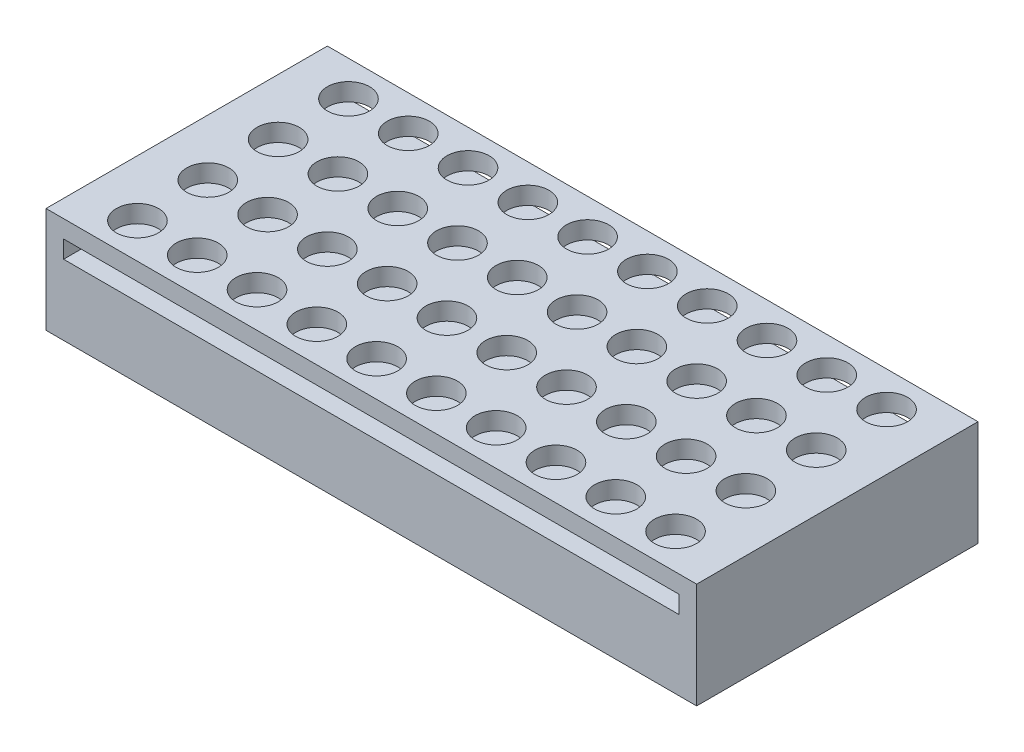
from build123d import *

# Parameters (mm, degrees)
SKETCH_1_W             = 355
SKETCH_1_H             = 80
EXTRUDE_3_DEPTH        = 30
SKETCH_2_W             = 345
SKETCH_2_H             = 5
CUT_EXTRUDE_1_DEPTH    = 366.136960605
SKETCH_3_R             = 6
CUT_EXTRUDE_2_DEPTH    = 5
PATTERN_LINEAR_1_COUNT = 20
PATTERN_LINEAR_1_PITCH = 17
PATTERN_LINEAR_2_COUNT = 2
PATTERN_LINEAR_2_PITCH = 20
SKETCH_8_R             = 8
SKETCH_7_R             = 6
PATTERN_LINEAR_4_COUNT = 20
PATTERN_LINEAR_4_PITCH = 17
PATTERN_LINEAR_5_COUNT = 2
PATTERN_LINEAR_5_PITCH = 20
SKETCH_10_W            = 177.5
SKETCH_10_H            = 30
CUT_EXTRUDE_3_DEPTH    = 188
SKETCH_11_W            = 7.5
SKETCH_11_H            = 80
EXTRUDE_4_DEPTH        = 30
SKETCH_12_W            = 2.5
SKETCH_12_H            = 5
CUT_EXTRUDE_4_DEPTH    = 98


with BuildPart() as part:
    # 草图1 → 凸台-拉伸3 (new body)
    with BuildSketch(Plane(origin=(0, 0, 0), x_dir=(1, 0, 0), z_dir=(0, 1, 0))):
        with Locations((177.5, 40)):
            Rectangle(SKETCH_1_W, SKETCH_1_H)
    extrude(amount=EXTRUDE_3_DEPTH)

    # 草图2 → 切除-拉伸1 (cut, through all)
    with BuildSketch(Plane.XY):
        with Locations((177.5, 22.5)):
            Rectangle(SKETCH_2_W, SKETCH_2_H)
    extrude(amount=-CUT_EXTRUDE_1_DEPTH, mode=Mode.SUBTRACT)

    # 草图3 → 切除-拉伸2 (cut)
    with BuildSketch(Plane(origin=(0, 30, 0), x_dir=(1, 0, 0), z_dir=(0, 1, 0))):
        with Locations(Location((16, 70, 0), (0, 0, 270))):
            Circle(SKETCH_3_R)
        with Locations(Location((33, 70, 0), (0, 0, 270))):
            Circle(SKETCH_3_R)
        with Locations(Location((50, 70, 0), (0, 0, 270))):
            Circle(SKETCH_3_R)
        with Locations(Location((67, 70, 0), (0, 0, 270))):
            Circle(SKETCH_3_R)
        with Locations(Location((84, 70, 0), (0, 0, 270))):
            Circle(SKETCH_3_R)
        with Locations(Location((101, 70, 0), (0, 0, 270))):
            Circle(SKETCH_3_R)
        with Locations(Location((118, 70, 0), (0, 0, 270))):
            Circle(SKETCH_3_R)
        with Locations(Location((135, 70, 0), (0, 0, 270))):
            Circle(SKETCH_3_R)
        with Locations(Location((152, 70, 0), (0, 0, 270))):
            Circle(SKETCH_3_R)
        with Locations(Location((169, 70, 0), (0, 0, 270))):
            Circle(SKETCH_3_R)
        with Locations(Location((186, 70, 0), (0, 0, 270))):
            Circle(SKETCH_3_R)
        with Locations(Location((203, 70, 0), (0, 0, 270))):
            Circle(SKETCH_3_R)
        with Locations(Location((220, 70, 0), (0, 0, 270))):
            Circle(SKETCH_3_R)
        with Locations(Location((237, 70, 0), (0, 0, 270))):
            Circle(SKETCH_3_R)
        with Locations(Location((254, 70, 0), (0, 0, 270))):
            Circle(SKETCH_3_R)
        with Locations(Location((271, 70, 0), (0, 0, 270))):
            Circle(SKETCH_3_R)
        with Locations(Location((288, 70, 0), (0, 0, 270))):
            Circle(SKETCH_3_R)
        with Locations(Location((305, 70, 0), (0, 0, 270))):
            Circle(SKETCH_3_R)
        with Locations(Location((322, 70, 0), (0, 0, 270))):
            Circle(SKETCH_3_R)
        with Locations(Location((339, 70, 0), (0, 0, 270))):
            Circle(SKETCH_3_R)
        with Locations(Location((16, 50, 0), (0, 0, 270))):
            Circle(SKETCH_3_R)
        with Locations(Location((16, 30, 0), (0, 0, 270))):
            Circle(SKETCH_3_R)
        with Locations(Location((16, 10, 0), (0, 0, 270))):
            Circle(SKETCH_3_R)
        with Locations(Location((33, 50, 0), (0, 0, 270))):
            Circle(SKETCH_3_R)
        with Locations(Location((50, 50, 0), (0, 0, 270))):
            Circle(SKETCH_3_R)
        with Locations(Location((67, 50, 0), (0, 0, 270))):
            Circle(SKETCH_3_R)
        with Locations(Location((84, 50, 0), (0, 0, 270))):
            Circle(SKETCH_3_R)
        with Locations(Location((101, 50, 0), (0, 0, 270))):
            Circle(SKETCH_3_R)
        with Locations(Location((118, 50, 0), (0, 0, 270))):
            Circle(SKETCH_3_R)
        with Locations(Location((135, 50, 0), (0, 0, 270))):
            Circle(SKETCH_3_R)
        with Locations(Location((152, 50, 0), (0, 0, 270))):
            Circle(SKETCH_3_R)
        with Locations(Location((169, 50, 0), (0, 0, 270))):
            Circle(SKETCH_3_R)
        with Locations(Location((186, 50, 0), (0, 0, 270))):
            Circle(SKETCH_3_R)
        with Locations(Location((203, 50, 0), (0, 0, 270))):
            Circle(SKETCH_3_R)
        with Locations(Location((220, 50, 0), (0, 0, 270))):
            Circle(SKETCH_3_R)
        with Locations(Location((237, 50, 0), (0, 0, 270))):
            Circle(SKETCH_3_R)
        with Locations(Location((254, 50, 0), (0, 0, 270))):
            Circle(SKETCH_3_R)
        with Locations(Location((271, 50, 0), (0, 0, 270))):
            Circle(SKETCH_3_R)
        with Locations(Location((288, 50, 0), (0, 0, 270))):
            Circle(SKETCH_3_R)
        with Locations(Location((305, 50, 0), (0, 0, 270))):
            Circle(SKETCH_3_R)
        with Locations(Location((322, 50, 0), (0, 0, 270))):
            Circle(SKETCH_3_R)
        with Locations(Location((339, 50, 0), (0, 0, 270))):
            Circle(SKETCH_3_R)
        with Locations(Location((33, 30, 0), (0, 0, 270))):
            Circle(SKETCH_3_R)
        with Locations(Location((50, 30, 0), (0, 0, 270))):
            Circle(SKETCH_3_R)
        with Locations(Location((67, 30, 0), (0, 0, 270))):
            Circle(SKETCH_3_R)
        with Locations(Location((84, 30, 0), (0, 0, 270))):
            Circle(SKETCH_3_R)
        with Locations(Location((101, 30, 0), (0, 0, 270))):
            Circle(SKETCH_3_R)
        with Locations(Location((118, 30, 0), (0, 0, 270))):
            Circle(SKETCH_3_R)
        with Locations(Location((135, 30, 0), (0, 0, 270))):
            Circle(SKETCH_3_R)
        with Locations(Location((152, 30, 0), (0, 0, 270))):
            Circle(SKETCH_3_R)
        with Locations(Location((169, 30, 0), (0, 0, 270))):
            Circle(SKETCH_3_R)
        with Locations(Location((186, 30, 0), (0, 0, 270))):
            Circle(SKETCH_3_R)
        with Locations(Location((203, 30, 0), (0, 0, 270))):
            Circle(SKETCH_3_R)
        with Locations(Location((220, 30, 0), (0, 0, 270))):
            Circle(SKETCH_3_R)
        with Locations(Location((237, 30, 0), (0, 0, 270))):
            Circle(SKETCH_3_R)
        with Locations(Location((254, 30, 0), (0, 0, 270))):
            Circle(SKETCH_3_R)
        with Locations(Location((271, 30, 0), (0, 0, 270))):
            Circle(SKETCH_3_R)
        with Locations(Location((288, 30, 0), (0, 0, 270))):
            Circle(SKETCH_3_R)
        with Locations(Location((305, 30, 0), (0, 0, 270))):
            Circle(SKETCH_3_R)
        with Locations(Location((322, 30, 0), (0, 0, 270))):
            Circle(SKETCH_3_R)
        with Locations(Location((339, 30, 0), (0, 0, 270))):
            Circle(SKETCH_3_R)
        with Locations(Location((33, 10, 0), (0, 0, 270))):
            Circle(SKETCH_3_R)
        with Locations(Location((50, 10, 0), (0, 0, 270))):
            Circle(SKETCH_3_R)
        with Locations(Location((67, 10, 0), (0, 0, 270))):
            Circle(SKETCH_3_R)
        with Locations(Location((84, 10, 0), (0, 0, 270))):
            Circle(SKETCH_3_R)
        with Locations(Location((101, 10, 0), (0, 0, 270))):
            Circle(SKETCH_3_R)
        with Locations(Location((118, 10, 0), (0, 0, 270))):
            Circle(SKETCH_3_R)
        with Locations(Location((135, 10, 0), (0, 0, 270))):
            Circle(SKETCH_3_R)
        with Locations(Location((152, 10, 0), (0, 0, 270))):
            Circle(SKETCH_3_R)
        with Locations(Location((169, 10, 0), (0, 0, 270))):
            Circle(SKETCH_3_R)
        with Locations(Location((186, 10, 0), (0, 0, 270))):
            Circle(SKETCH_3_R)
        with Locations(Location((203, 10, 0), (0, 0, 270))):
            Circle(SKETCH_3_R)
        with Locations(Location((220, 10, 0), (0, 0, 270))):
            Circle(SKETCH_3_R)
        with Locations(Location((237, 10, 0), (0, 0, 270))):
            Circle(SKETCH_3_R)
        with Locations(Location((254, 10, 0), (0, 0, 270))):
            Circle(SKETCH_3_R)
        with Locations(Location((271, 10, 0), (0, 0, 270))):
            Circle(SKETCH_3_R)
        with Locations(Location((288, 10, 0), (0, 0, 270))):
            Circle(SKETCH_3_R)
        with Locations(Location((305, 10, 0), (0, 0, 270))):
            Circle(SKETCH_3_R)
        with Locations(Location((322, 10, 0), (0, 0, 270))):
            Circle(SKETCH_3_R)
        with Locations(Location((339, 10, 0), (0, 0, 270))):
            Circle(SKETCH_3_R)
    extrude(amount=-CUT_EXTRUDE_2_DEPTH, mode=Mode.SUBTRACT)

    # 切除-放样1: read off the stored shape, not the designer's step
    # 切除-放样1: loft between two sections, ruled curve by curve
    loft_1_from = [
        Edge.make_bspline([(16.29384385, 0, -14.49039595), (7.313051949, 0, -15.07808365), (6.725364249, 0, -6.09729175), (15.70615615, 0, -5.50960405), (24.686948051, 0, -4.92191635), (25.274635751, 0, -13.90270825), (16.29384385, 0, -14.49039595)], [0, 0, 0, 0, 0.5, 0.5, 0.5, 1, 1, 1, 1], 3, [1, 0.333333333, 0.333333333, 1, 0.333333333, 0.333333333, 1]),
    ]
    loft_1_to = [
        Edge.make_bspline([(15.369563504, 20, -12.419204378), (10.531154747, 20, -11.158331387), (11.792027739, 20, -6.31992263), (16.630436496, 20, -7.580795622), (21.468845253, 20, -8.841668613), (20.207972261, 20, -13.68007737), (15.369563504, 20, -12.419204378)], [0, 0, 0, 0, 0.5, 0.5, 0.5, 1, 1, 1, 1], 3, [1, 0.333333333, 0.333333333, 1, 0.333333333, 0.333333333, 1]),
    ]
    loft_1 = Solid(Shell([*[Face.make_surface_from_curves(loft_1_from[k], loft_1_to[k]) for k in range(1)], Face(Wire(loft_1_from)), Face(Wire(loft_1_to))]))
    add(loft_1, mode=Mode.SUBTRACT)

    # 阵列(线性)1: 切除-放样1 ×20
    with Locations(*[(i * PATTERN_LINEAR_1_PITCH, 0, 0) for i in range(1, PATTERN_LINEAR_1_COUNT)]):
        add(loft_1, mode=Mode.SUBTRACT)

    # 阵列(线性)2: 切除-放样1 ×2
    with Locations(*[(0, 0, -i * PATTERN_LINEAR_2_PITCH) for i in range(1, PATTERN_LINEAR_2_COUNT)]):
        add(loft_1, mode=Mode.SUBTRACT)

    # 阵列(线性)3: read off the stored shape, not the designer's step
    # 阵列(线性)3: loft between two sections, ruled curve by curve
    pattern_linear_3_from = [
        Edge.make_bspline([(339.29384385, 0, -34.49039595), (330.313051949, 0, -35.07808365), (329.725364249, 0, -26.09729175), (338.70615615, 0, -25.50960405), (347.686948051, 0, -24.92191635), (348.274635751, 0, -33.90270825), (339.29384385, 0, -34.49039595)], [0, 0, 0, 0, 0.5, 0.5, 0.5, 1, 1, 1, 1], 3, [1, 0.333333333, 0.333333333, 1, 0.333333333, 0.333333333, 1]),
    ]
    pattern_linear_3_to = [
        Edge.make_bspline([(338.369563504, 20, -32.419204378), (333.531154747, 20, -31.158331387), (334.792027739, 20, -26.31992263), (339.630436496, 20, -27.580795622), (344.468845253, 20, -28.841668613), (343.207972261, 20, -33.68007737), (338.369563504, 20, -32.419204378)], [0, 0, 0, 0, 0.5, 0.5, 0.5, 1, 1, 1, 1], 3, [1, 0.333333333, 0.333333333, 1, 0.333333333, 0.333333333, 1]),
    ]
    pattern_linear_3 = Solid(Shell([*[Face.make_surface_from_curves(pattern_linear_3_from[k], pattern_linear_3_to[k]) for k in range(1)], Face(Wire(pattern_linear_3_from)), Face(Wire(pattern_linear_3_to))]))
    add(pattern_linear_3, mode=Mode.SUBTRACT)

    # Pattern Linear 3 2: loft between two sections, ruled curve by curve
    pattern_linear_3_2_from = [
        Edge.make_bspline([(322.29384385, 0, -34.49039595), (313.313051949, 0, -35.07808365), (312.725364249, 0, -26.09729175), (321.70615615, 0, -25.50960405), (330.686948051, 0, -24.92191635), (331.274635751, 0, -33.90270825), (322.29384385, 0, -34.49039595)], [0, 0, 0, 0, 0.5, 0.5, 0.5, 1, 1, 1, 1], 3, [1, 0.333333333, 0.333333333, 1, 0.333333333, 0.333333333, 1]),
    ]
    pattern_linear_3_2_to = [
        Edge.make_bspline([(321.369563504, 20, -32.419204378), (316.531154747, 20, -31.158331387), (317.792027739, 20, -26.31992263), (322.630436496, 20, -27.580795622), (327.468845253, 20, -28.841668613), (326.207972261, 20, -33.68007737), (321.369563504, 20, -32.419204378)], [0, 0, 0, 0, 0.5, 0.5, 0.5, 1, 1, 1, 1], 3, [1, 0.333333333, 0.333333333, 1, 0.333333333, 0.333333333, 1]),
    ]
    pattern_linear_3_2 = Solid(Shell([*[Face.make_surface_from_curves(pattern_linear_3_2_from[k], pattern_linear_3_2_to[k]) for k in range(1)], Face(Wire(pattern_linear_3_2_from)), Face(Wire(pattern_linear_3_2_to))]))
    add(pattern_linear_3_2, mode=Mode.SUBTRACT)

    # Pattern Linear 3 3: loft between two sections, ruled curve by curve
    pattern_linear_3_3_from = [
        Edge.make_bspline([(305.29384385, 0, -34.49039595), (296.313051949, 0, -35.07808365), (295.725364249, 0, -26.09729175), (304.70615615, 0, -25.50960405), (313.686948051, 0, -24.92191635), (314.274635751, 0, -33.90270825), (305.29384385, 0, -34.49039595)], [0, 0, 0, 0, 0.5, 0.5, 0.5, 1, 1, 1, 1], 3, [1, 0.333333333, 0.333333333, 1, 0.333333333, 0.333333333, 1]),
    ]
    pattern_linear_3_3_to = [
        Edge.make_bspline([(304.369563504, 20, -32.419204378), (299.531154747, 20, -31.158331387), (300.792027739, 20, -26.31992263), (305.630436496, 20, -27.580795622), (310.468845253, 20, -28.841668613), (309.207972261, 20, -33.68007737), (304.369563504, 20, -32.419204378)], [0, 0, 0, 0, 0.5, 0.5, 0.5, 1, 1, 1, 1], 3, [1, 0.333333333, 0.333333333, 1, 0.333333333, 0.333333333, 1]),
    ]
    pattern_linear_3_3 = Solid(Shell([*[Face.make_surface_from_curves(pattern_linear_3_3_from[k], pattern_linear_3_3_to[k]) for k in range(1)], Face(Wire(pattern_linear_3_3_from)), Face(Wire(pattern_linear_3_3_to))]))
    add(pattern_linear_3_3, mode=Mode.SUBTRACT)

    # Pattern Linear 3 4: loft between two sections, ruled curve by curve
    pattern_linear_3_4_from = [
        Edge.make_bspline([(288.29384385, 0, -34.49039595), (279.313051949, 0, -35.07808365), (278.725364249, 0, -26.09729175), (287.70615615, 0, -25.50960405), (296.686948051, 0, -24.92191635), (297.274635751, 0, -33.90270825), (288.29384385, 0, -34.49039595)], [0, 0, 0, 0, 0.5, 0.5, 0.5, 1, 1, 1, 1], 3, [1, 0.333333333, 0.333333333, 1, 0.333333333, 0.333333333, 1]),
    ]
    pattern_linear_3_4_to = [
        Edge.make_bspline([(287.369563504, 20, -32.419204378), (282.531154747, 20, -31.158331387), (283.792027739, 20, -26.31992263), (288.630436496, 20, -27.580795622), (293.468845253, 20, -28.841668613), (292.207972261, 20, -33.68007737), (287.369563504, 20, -32.419204378)], [0, 0, 0, 0, 0.5, 0.5, 0.5, 1, 1, 1, 1], 3, [1, 0.333333333, 0.333333333, 1, 0.333333333, 0.333333333, 1]),
    ]
    pattern_linear_3_4 = Solid(Shell([*[Face.make_surface_from_curves(pattern_linear_3_4_from[k], pattern_linear_3_4_to[k]) for k in range(1)], Face(Wire(pattern_linear_3_4_from)), Face(Wire(pattern_linear_3_4_to))]))
    add(pattern_linear_3_4, mode=Mode.SUBTRACT)

    # Pattern Linear 3 5: loft between two sections, ruled curve by curve
    pattern_linear_3_5_from = [
        Edge.make_bspline([(271.29384385, 0, -34.49039595), (262.313051949, 0, -35.07808365), (261.725364249, 0, -26.09729175), (270.70615615, 0, -25.50960405), (279.686948051, 0, -24.92191635), (280.274635751, 0, -33.90270825), (271.29384385, 0, -34.49039595)], [0, 0, 0, 0, 0.5, 0.5, 0.5, 1, 1, 1, 1], 3, [1, 0.333333333, 0.333333333, 1, 0.333333333, 0.333333333, 1]),
    ]
    pattern_linear_3_5_to = [
        Edge.make_bspline([(270.369563504, 20, -32.419204378), (265.531154747, 20, -31.158331387), (266.792027739, 20, -26.31992263), (271.630436496, 20, -27.580795622), (276.468845253, 20, -28.841668613), (275.207972261, 20, -33.68007737), (270.369563504, 20, -32.419204378)], [0, 0, 0, 0, 0.5, 0.5, 0.5, 1, 1, 1, 1], 3, [1, 0.333333333, 0.333333333, 1, 0.333333333, 0.333333333, 1]),
    ]
    pattern_linear_3_5 = Solid(Shell([*[Face.make_surface_from_curves(pattern_linear_3_5_from[k], pattern_linear_3_5_to[k]) for k in range(1)], Face(Wire(pattern_linear_3_5_from)), Face(Wire(pattern_linear_3_5_to))]))
    add(pattern_linear_3_5, mode=Mode.SUBTRACT)

    # Pattern Linear 3 6: loft between two sections, ruled curve by curve
    pattern_linear_3_6_from = [
        Edge.make_bspline([(254.29384385, 0, -34.49039595), (245.313051949, 0, -35.07808365), (244.725364249, 0, -26.09729175), (253.70615615, 0, -25.50960405), (262.686948051, 0, -24.92191635), (263.274635751, 0, -33.90270825), (254.29384385, 0, -34.49039595)], [0, 0, 0, 0, 0.5, 0.5, 0.5, 1, 1, 1, 1], 3, [1, 0.333333333, 0.333333333, 1, 0.333333333, 0.333333333, 1]),
    ]
    pattern_linear_3_6_to = [
        Edge.make_bspline([(253.369563504, 20, -32.419204378), (248.531154747, 20, -31.158331387), (249.792027739, 20, -26.31992263), (254.630436496, 20, -27.580795622), (259.468845253, 20, -28.841668613), (258.207972261, 20, -33.68007737), (253.369563504, 20, -32.419204378)], [0, 0, 0, 0, 0.5, 0.5, 0.5, 1, 1, 1, 1], 3, [1, 0.333333333, 0.333333333, 1, 0.333333333, 0.333333333, 1]),
    ]
    pattern_linear_3_6 = Solid(Shell([*[Face.make_surface_from_curves(pattern_linear_3_6_from[k], pattern_linear_3_6_to[k]) for k in range(1)], Face(Wire(pattern_linear_3_6_from)), Face(Wire(pattern_linear_3_6_to))]))
    add(pattern_linear_3_6, mode=Mode.SUBTRACT)

    # Pattern Linear 3 7: loft between two sections, ruled curve by curve
    pattern_linear_3_7_from = [
        Edge.make_bspline([(237.29384385, 0, -34.49039595), (228.313051949, 0, -35.07808365), (227.725364249, 0, -26.09729175), (236.70615615, 0, -25.50960405), (245.686948051, 0, -24.92191635), (246.274635751, 0, -33.90270825), (237.29384385, 0, -34.49039595)], [0, 0, 0, 0, 0.5, 0.5, 0.5, 1, 1, 1, 1], 3, [1, 0.333333333, 0.333333333, 1, 0.333333333, 0.333333333, 1]),
    ]
    pattern_linear_3_7_to = [
        Edge.make_bspline([(236.369563504, 20, -32.419204378), (231.531154747, 20, -31.158331387), (232.792027739, 20, -26.31992263), (237.630436496, 20, -27.580795622), (242.468845253, 20, -28.841668613), (241.207972261, 20, -33.68007737), (236.369563504, 20, -32.419204378)], [0, 0, 0, 0, 0.5, 0.5, 0.5, 1, 1, 1, 1], 3, [1, 0.333333333, 0.333333333, 1, 0.333333333, 0.333333333, 1]),
    ]
    pattern_linear_3_7 = Solid(Shell([*[Face.make_surface_from_curves(pattern_linear_3_7_from[k], pattern_linear_3_7_to[k]) for k in range(1)], Face(Wire(pattern_linear_3_7_from)), Face(Wire(pattern_linear_3_7_to))]))
    add(pattern_linear_3_7, mode=Mode.SUBTRACT)

    # Pattern Linear 3 8: loft between two sections, ruled curve by curve
    pattern_linear_3_8_from = [
        Edge.make_bspline([(220.29384385, 0, -34.49039595), (211.313051949, 0, -35.07808365), (210.725364249, 0, -26.09729175), (219.70615615, 0, -25.50960405), (228.686948051, 0, -24.92191635), (229.274635751, 0, -33.90270825), (220.29384385, 0, -34.49039595)], [0, 0, 0, 0, 0.5, 0.5, 0.5, 1, 1, 1, 1], 3, [1, 0.333333333, 0.333333333, 1, 0.333333333, 0.333333333, 1]),
    ]
    pattern_linear_3_8_to = [
        Edge.make_bspline([(219.369563504, 20, -32.419204378), (214.531154747, 20, -31.158331387), (215.792027739, 20, -26.31992263), (220.630436496, 20, -27.580795622), (225.468845253, 20, -28.841668613), (224.207972261, 20, -33.68007737), (219.369563504, 20, -32.419204378)], [0, 0, 0, 0, 0.5, 0.5, 0.5, 1, 1, 1, 1], 3, [1, 0.333333333, 0.333333333, 1, 0.333333333, 0.333333333, 1]),
    ]
    pattern_linear_3_8 = Solid(Shell([*[Face.make_surface_from_curves(pattern_linear_3_8_from[k], pattern_linear_3_8_to[k]) for k in range(1)], Face(Wire(pattern_linear_3_8_from)), Face(Wire(pattern_linear_3_8_to))]))
    add(pattern_linear_3_8, mode=Mode.SUBTRACT)

    # Pattern Linear 3 9: loft between two sections, ruled curve by curve
    pattern_linear_3_9_from = [
        Edge.make_bspline([(203.29384385, 0, -34.49039595), (194.313051949, 0, -35.07808365), (193.725364249, 0, -26.09729175), (202.70615615, 0, -25.50960405), (211.686948051, 0, -24.92191635), (212.274635751, 0, -33.90270825), (203.29384385, 0, -34.49039595)], [0, 0, 0, 0, 0.5, 0.5, 0.5, 1, 1, 1, 1], 3, [1, 0.333333333, 0.333333333, 1, 0.333333333, 0.333333333, 1]),
    ]
    pattern_linear_3_9_to = [
        Edge.make_bspline([(202.369563504, 20, -32.419204378), (197.531154747, 20, -31.158331387), (198.792027739, 20, -26.31992263), (203.630436496, 20, -27.580795622), (208.468845253, 20, -28.841668613), (207.207972261, 20, -33.68007737), (202.369563504, 20, -32.419204378)], [0, 0, 0, 0, 0.5, 0.5, 0.5, 1, 1, 1, 1], 3, [1, 0.333333333, 0.333333333, 1, 0.333333333, 0.333333333, 1]),
    ]
    pattern_linear_3_9 = Solid(Shell([*[Face.make_surface_from_curves(pattern_linear_3_9_from[k], pattern_linear_3_9_to[k]) for k in range(1)], Face(Wire(pattern_linear_3_9_from)), Face(Wire(pattern_linear_3_9_to))]))
    add(pattern_linear_3_9, mode=Mode.SUBTRACT)

    # Pattern Linear 3 10: loft between two sections, ruled curve by curve
    pattern_linear_3_10_from = [
        Edge.make_bspline([(186.29384385, 0, -34.49039595), (177.313051949, 0, -35.07808365), (176.725364249, 0, -26.09729175), (185.70615615, 0, -25.50960405), (194.686948051, 0, -24.92191635), (195.274635751, 0, -33.90270825), (186.29384385, 0, -34.49039595)], [0, 0, 0, 0, 0.5, 0.5, 0.5, 1, 1, 1, 1], 3, [1, 0.333333333, 0.333333333, 1, 0.333333333, 0.333333333, 1]),
    ]
    pattern_linear_3_10_to = [
        Edge.make_bspline([(185.369563504, 20, -32.419204378), (180.531154747, 20, -31.158331387), (181.792027739, 20, -26.31992263), (186.630436496, 20, -27.580795622), (191.468845253, 20, -28.841668613), (190.207972261, 20, -33.68007737), (185.369563504, 20, -32.419204378)], [0, 0, 0, 0, 0.5, 0.5, 0.5, 1, 1, 1, 1], 3, [1, 0.333333333, 0.333333333, 1, 0.333333333, 0.333333333, 1]),
    ]
    pattern_linear_3_10 = Solid(Shell([*[Face.make_surface_from_curves(pattern_linear_3_10_from[k], pattern_linear_3_10_to[k]) for k in range(1)], Face(Wire(pattern_linear_3_10_from)), Face(Wire(pattern_linear_3_10_to))]))
    add(pattern_linear_3_10, mode=Mode.SUBTRACT)

    # Pattern Linear 3 11: loft between two sections, ruled curve by curve
    pattern_linear_3_11_from = [
        Edge.make_bspline([(169.29384385, 0, -34.49039595), (160.313051949, 0, -35.07808365), (159.725364249, 0, -26.09729175), (168.70615615, 0, -25.50960405), (177.686948051, 0, -24.92191635), (178.274635751, 0, -33.90270825), (169.29384385, 0, -34.49039595)], [0, 0, 0, 0, 0.5, 0.5, 0.5, 1, 1, 1, 1], 3, [1, 0.333333333, 0.333333333, 1, 0.333333333, 0.333333333, 1]),
    ]
    pattern_linear_3_11_to = [
        Edge.make_bspline([(168.369563504, 20, -32.419204378), (163.531154747, 20, -31.158331387), (164.792027739, 20, -26.31992263), (169.630436496, 20, -27.580795622), (174.468845253, 20, -28.841668613), (173.207972261, 20, -33.68007737), (168.369563504, 20, -32.419204378)], [0, 0, 0, 0, 0.5, 0.5, 0.5, 1, 1, 1, 1], 3, [1, 0.333333333, 0.333333333, 1, 0.333333333, 0.333333333, 1]),
    ]
    pattern_linear_3_11 = Solid(Shell([*[Face.make_surface_from_curves(pattern_linear_3_11_from[k], pattern_linear_3_11_to[k]) for k in range(1)], Face(Wire(pattern_linear_3_11_from)), Face(Wire(pattern_linear_3_11_to))]))
    add(pattern_linear_3_11, mode=Mode.SUBTRACT)

    # Pattern Linear 3 12: loft between two sections, ruled curve by curve
    pattern_linear_3_12_from = [
        Edge.make_bspline([(152.29384385, 0, -34.49039595), (143.313051949, 0, -35.07808365), (142.725364249, 0, -26.09729175), (151.70615615, 0, -25.50960405), (160.686948051, 0, -24.92191635), (161.274635751, 0, -33.90270825), (152.29384385, 0, -34.49039595)], [0, 0, 0, 0, 0.5, 0.5, 0.5, 1, 1, 1, 1], 3, [1, 0.333333333, 0.333333333, 1, 0.333333333, 0.333333333, 1]),
    ]
    pattern_linear_3_12_to = [
        Edge.make_bspline([(151.369563504, 20, -32.419204378), (146.531154747, 20, -31.158331387), (147.792027739, 20, -26.31992263), (152.630436496, 20, -27.580795622), (157.468845253, 20, -28.841668613), (156.207972261, 20, -33.68007737), (151.369563504, 20, -32.419204378)], [0, 0, 0, 0, 0.5, 0.5, 0.5, 1, 1, 1, 1], 3, [1, 0.333333333, 0.333333333, 1, 0.333333333, 0.333333333, 1]),
    ]
    pattern_linear_3_12 = Solid(Shell([*[Face.make_surface_from_curves(pattern_linear_3_12_from[k], pattern_linear_3_12_to[k]) for k in range(1)], Face(Wire(pattern_linear_3_12_from)), Face(Wire(pattern_linear_3_12_to))]))
    add(pattern_linear_3_12, mode=Mode.SUBTRACT)

    # Pattern Linear 3 13: loft between two sections, ruled curve by curve
    pattern_linear_3_13_from = [
        Edge.make_bspline([(135.29384385, 0, -34.49039595), (126.313051949, 0, -35.07808365), (125.725364249, 0, -26.09729175), (134.70615615, 0, -25.50960405), (143.686948051, 0, -24.92191635), (144.274635751, 0, -33.90270825), (135.29384385, 0, -34.49039595)], [0, 0, 0, 0, 0.5, 0.5, 0.5, 1, 1, 1, 1], 3, [1, 0.333333333, 0.333333333, 1, 0.333333333, 0.333333333, 1]),
    ]
    pattern_linear_3_13_to = [
        Edge.make_bspline([(134.369563504, 20, -32.419204378), (129.531154747, 20, -31.158331387), (130.792027739, 20, -26.31992263), (135.630436496, 20, -27.580795622), (140.468845253, 20, -28.841668613), (139.207972261, 20, -33.68007737), (134.369563504, 20, -32.419204378)], [0, 0, 0, 0, 0.5, 0.5, 0.5, 1, 1, 1, 1], 3, [1, 0.333333333, 0.333333333, 1, 0.333333333, 0.333333333, 1]),
    ]
    pattern_linear_3_13 = Solid(Shell([*[Face.make_surface_from_curves(pattern_linear_3_13_from[k], pattern_linear_3_13_to[k]) for k in range(1)], Face(Wire(pattern_linear_3_13_from)), Face(Wire(pattern_linear_3_13_to))]))
    add(pattern_linear_3_13, mode=Mode.SUBTRACT)

    # Pattern Linear 3 14: loft between two sections, ruled curve by curve
    pattern_linear_3_14_from = [
        Edge.make_bspline([(118.29384385, 0, -34.49039595), (109.313051949, 0, -35.07808365), (108.725364249, 0, -26.09729175), (117.70615615, 0, -25.50960405), (126.686948051, 0, -24.92191635), (127.274635751, 0, -33.90270825), (118.29384385, 0, -34.49039595)], [0, 0, 0, 0, 0.5, 0.5, 0.5, 1, 1, 1, 1], 3, [1, 0.333333333, 0.333333333, 1, 0.333333333, 0.333333333, 1]),
    ]
    pattern_linear_3_14_to = [
        Edge.make_bspline([(117.369563504, 20, -32.419204378), (112.531154747, 20, -31.158331387), (113.792027739, 20, -26.31992263), (118.630436496, 20, -27.580795622), (123.468845253, 20, -28.841668613), (122.207972261, 20, -33.68007737), (117.369563504, 20, -32.419204378)], [0, 0, 0, 0, 0.5, 0.5, 0.5, 1, 1, 1, 1], 3, [1, 0.333333333, 0.333333333, 1, 0.333333333, 0.333333333, 1]),
    ]
    pattern_linear_3_14 = Solid(Shell([*[Face.make_surface_from_curves(pattern_linear_3_14_from[k], pattern_linear_3_14_to[k]) for k in range(1)], Face(Wire(pattern_linear_3_14_from)), Face(Wire(pattern_linear_3_14_to))]))
    add(pattern_linear_3_14, mode=Mode.SUBTRACT)

    # Pattern Linear 3 15: loft between two sections, ruled curve by curve
    pattern_linear_3_15_from = [
        Edge.make_bspline([(101.29384385, 0, -34.49039595), (92.313051949, 0, -35.07808365), (91.725364249, 0, -26.09729175), (100.70615615, 0, -25.50960405), (109.686948051, 0, -24.92191635), (110.274635751, 0, -33.90270825), (101.29384385, 0, -34.49039595)], [0, 0, 0, 0, 0.5, 0.5, 0.5, 1, 1, 1, 1], 3, [1, 0.333333333, 0.333333333, 1, 0.333333333, 0.333333333, 1]),
    ]
    pattern_linear_3_15_to = [
        Edge.make_bspline([(100.369563504, 20, -32.419204378), (95.531154747, 20, -31.158331387), (96.792027739, 20, -26.31992263), (101.630436496, 20, -27.580795622), (106.468845253, 20, -28.841668613), (105.207972261, 20, -33.68007737), (100.369563504, 20, -32.419204378)], [0, 0, 0, 0, 0.5, 0.5, 0.5, 1, 1, 1, 1], 3, [1, 0.333333333, 0.333333333, 1, 0.333333333, 0.333333333, 1]),
    ]
    pattern_linear_3_15 = Solid(Shell([*[Face.make_surface_from_curves(pattern_linear_3_15_from[k], pattern_linear_3_15_to[k]) for k in range(1)], Face(Wire(pattern_linear_3_15_from)), Face(Wire(pattern_linear_3_15_to))]))
    add(pattern_linear_3_15, mode=Mode.SUBTRACT)

    # Pattern Linear 3 16: loft between two sections, ruled curve by curve
    pattern_linear_3_16_from = [
        Edge.make_bspline([(84.29384385, 0, -34.49039595), (75.313051949, 0, -35.07808365), (74.725364249, 0, -26.09729175), (83.70615615, 0, -25.50960405), (92.686948051, 0, -24.92191635), (93.274635751, 0, -33.90270825), (84.29384385, 0, -34.49039595)], [0, 0, 0, 0, 0.5, 0.5, 0.5, 1, 1, 1, 1], 3, [1, 0.333333333, 0.333333333, 1, 0.333333333, 0.333333333, 1]),
    ]
    pattern_linear_3_16_to = [
        Edge.make_bspline([(83.369563504, 20, -32.419204378), (78.531154747, 20, -31.158331387), (79.792027739, 20, -26.31992263), (84.630436496, 20, -27.580795622), (89.468845253, 20, -28.841668613), (88.207972261, 20, -33.68007737), (83.369563504, 20, -32.419204378)], [0, 0, 0, 0, 0.5, 0.5, 0.5, 1, 1, 1, 1], 3, [1, 0.333333333, 0.333333333, 1, 0.333333333, 0.333333333, 1]),
    ]
    pattern_linear_3_16 = Solid(Shell([*[Face.make_surface_from_curves(pattern_linear_3_16_from[k], pattern_linear_3_16_to[k]) for k in range(1)], Face(Wire(pattern_linear_3_16_from)), Face(Wire(pattern_linear_3_16_to))]))
    add(pattern_linear_3_16, mode=Mode.SUBTRACT)

    # Pattern Linear 3 17: loft between two sections, ruled curve by curve
    pattern_linear_3_17_from = [
        Edge.make_bspline([(67.29384385, 0, -34.49039595), (58.313051949, 0, -35.07808365), (57.725364249, 0, -26.09729175), (66.70615615, 0, -25.50960405), (75.686948051, 0, -24.92191635), (76.274635751, 0, -33.90270825), (67.29384385, 0, -34.49039595)], [0, 0, 0, 0, 0.5, 0.5, 0.5, 1, 1, 1, 1], 3, [1, 0.333333333, 0.333333333, 1, 0.333333333, 0.333333333, 1]),
    ]
    pattern_linear_3_17_to = [
        Edge.make_bspline([(66.369563504, 20, -32.419204378), (61.531154747, 20, -31.158331387), (62.792027739, 20, -26.31992263), (67.630436496, 20, -27.580795622), (72.468845253, 20, -28.841668613), (71.207972261, 20, -33.68007737), (66.369563504, 20, -32.419204378)], [0, 0, 0, 0, 0.5, 0.5, 0.5, 1, 1, 1, 1], 3, [1, 0.333333333, 0.333333333, 1, 0.333333333, 0.333333333, 1]),
    ]
    pattern_linear_3_17 = Solid(Shell([*[Face.make_surface_from_curves(pattern_linear_3_17_from[k], pattern_linear_3_17_to[k]) for k in range(1)], Face(Wire(pattern_linear_3_17_from)), Face(Wire(pattern_linear_3_17_to))]))
    add(pattern_linear_3_17, mode=Mode.SUBTRACT)

    # Pattern Linear 3 18: loft between two sections, ruled curve by curve
    pattern_linear_3_18_from = [
        Edge.make_bspline([(50.29384385, 0, -34.49039595), (41.313051949, 0, -35.07808365), (40.725364249, 0, -26.09729175), (49.70615615, 0, -25.50960405), (58.686948051, 0, -24.92191635), (59.274635751, 0, -33.90270825), (50.29384385, 0, -34.49039595)], [0, 0, 0, 0, 0.5, 0.5, 0.5, 1, 1, 1, 1], 3, [1, 0.333333333, 0.333333333, 1, 0.333333333, 0.333333333, 1]),
    ]
    pattern_linear_3_18_to = [
        Edge.make_bspline([(49.369563504, 20, -32.419204378), (44.531154747, 20, -31.158331387), (45.792027739, 20, -26.31992263), (50.630436496, 20, -27.580795622), (55.468845253, 20, -28.841668613), (54.207972261, 20, -33.68007737), (49.369563504, 20, -32.419204378)], [0, 0, 0, 0, 0.5, 0.5, 0.5, 1, 1, 1, 1], 3, [1, 0.333333333, 0.333333333, 1, 0.333333333, 0.333333333, 1]),
    ]
    pattern_linear_3_18 = Solid(Shell([*[Face.make_surface_from_curves(pattern_linear_3_18_from[k], pattern_linear_3_18_to[k]) for k in range(1)], Face(Wire(pattern_linear_3_18_from)), Face(Wire(pattern_linear_3_18_to))]))
    add(pattern_linear_3_18, mode=Mode.SUBTRACT)

    # Pattern Linear 3 19: loft between two sections, ruled curve by curve
    pattern_linear_3_19_from = [
        Edge.make_bspline([(33.29384385, 0, -34.49039595), (24.313051949, 0, -35.07808365), (23.725364249, 0, -26.09729175), (32.70615615, 0, -25.50960405), (41.686948051, 0, -24.92191635), (42.274635751, 0, -33.90270825), (33.29384385, 0, -34.49039595)], [0, 0, 0, 0, 0.5, 0.5, 0.5, 1, 1, 1, 1], 3, [1, 0.333333333, 0.333333333, 1, 0.333333333, 0.333333333, 1]),
    ]
    pattern_linear_3_19_to = [
        Edge.make_bspline([(32.369563504, 20, -32.419204378), (27.531154747, 20, -31.158331387), (28.792027739, 20, -26.31992263), (33.630436496, 20, -27.580795622), (38.468845253, 20, -28.841668613), (37.207972261, 20, -33.68007737), (32.369563504, 20, -32.419204378)], [0, 0, 0, 0, 0.5, 0.5, 0.5, 1, 1, 1, 1], 3, [1, 0.333333333, 0.333333333, 1, 0.333333333, 0.333333333, 1]),
    ]
    pattern_linear_3_19 = Solid(Shell([*[Face.make_surface_from_curves(pattern_linear_3_19_from[k], pattern_linear_3_19_to[k]) for k in range(1)], Face(Wire(pattern_linear_3_19_from)), Face(Wire(pattern_linear_3_19_to))]))
    add(pattern_linear_3_19, mode=Mode.SUBTRACT)

    # 草图8 → 切除-放样2 section 0
    with BuildSketch(Plane.XZ):
        with Locations((16, -50)):
            Circle(SKETCH_8_R)
    # 草图7 → 切除-放样2 section 1
    with BuildSketch(Plane(origin=(0, 20, 0), x_dir=(1, 0, 0), z_dir=(0, 1, 0))):
        with Locations((16, 50)):
            Circle(SKETCH_7_R)
    loft_2 = loft(mode=Mode.SUBTRACT)

    # 阵列(线性)4: 切除-放样2 ×20
    with Locations(*[(i * PATTERN_LINEAR_4_PITCH, 0, 0) for i in range(1, PATTERN_LINEAR_4_COUNT)]):
        add(loft_2, mode=Mode.SUBTRACT)

    # 阵列(线性)5: 切除-放样2 ×2
    with Locations(*[(0, 0, -i * PATTERN_LINEAR_5_PITCH) for i in range(1, PATTERN_LINEAR_5_COUNT)]):
        add(loft_2, mode=Mode.SUBTRACT)

    # 阵列(线性)6: read off the stored shape, not the designer's step
    # 阵列(线性)6: loft between two sections, ruled curve by curve
    pattern_linear_6_from = [
        Edge.make_three_point_arc((33, 20, -76), (39, 20, -70), (33, 20, -64)),
        Edge.make_three_point_arc((33, 20, -64), (27, 20, -70), (33, 20, -76)),
    ]
    pattern_linear_6_to = [
        Edge.make_three_point_arc((33, 0, -78), (41, 0, -70), (33, 0, -62)),
        Edge.make_three_point_arc((33, 0, -62), (25, 0, -70), (33, 0, -78)),
    ]
    pattern_linear_6 = Solid(Shell([*[Face.make_surface_from_curves(pattern_linear_6_from[k], pattern_linear_6_to[k]) for k in range(2)], Face(Wire(pattern_linear_6_from)), Face(Wire(pattern_linear_6_to))]))
    add(pattern_linear_6, mode=Mode.SUBTRACT)

    # Pattern Linear 6 2: loft between two sections, ruled curve by curve
    pattern_linear_6_2_from = [
        Edge.make_three_point_arc((50, 20, -76), (56, 20, -70), (50, 20, -64)),
        Edge.make_three_point_arc((50, 20, -64), (44, 20, -70), (50, 20, -76)),
    ]
    pattern_linear_6_2_to = [
        Edge.make_three_point_arc((50, 0, -78), (58, 0, -70), (50, 0, -62)),
        Edge.make_three_point_arc((50, 0, -62), (42, 0, -70), (50, 0, -78)),
    ]
    pattern_linear_6_2 = Solid(Shell([*[Face.make_surface_from_curves(pattern_linear_6_2_from[k], pattern_linear_6_2_to[k]) for k in range(2)], Face(Wire(pattern_linear_6_2_from)), Face(Wire(pattern_linear_6_2_to))]))
    add(pattern_linear_6_2, mode=Mode.SUBTRACT)

    # Pattern Linear 6 3: loft between two sections, ruled curve by curve
    pattern_linear_6_3_from = [
        Edge.make_three_point_arc((67, 20, -76), (73, 20, -70), (67, 20, -64)),
        Edge.make_three_point_arc((67, 20, -64), (61, 20, -70), (67, 20, -76)),
    ]
    pattern_linear_6_3_to = [
        Edge.make_three_point_arc((67, 0, -78), (75, 0, -70), (67, 0, -62)),
        Edge.make_three_point_arc((67, 0, -62), (59, 0, -70), (67, 0, -78)),
    ]
    pattern_linear_6_3 = Solid(Shell([*[Face.make_surface_from_curves(pattern_linear_6_3_from[k], pattern_linear_6_3_to[k]) for k in range(2)], Face(Wire(pattern_linear_6_3_from)), Face(Wire(pattern_linear_6_3_to))]))
    add(pattern_linear_6_3, mode=Mode.SUBTRACT)

    # Pattern Linear 6 4: loft between two sections, ruled curve by curve
    pattern_linear_6_4_from = [
        Edge.make_three_point_arc((84, 20, -76), (90, 20, -70), (84, 20, -64)),
        Edge.make_three_point_arc((84, 20, -64), (78, 20, -70), (84, 20, -76)),
    ]
    pattern_linear_6_4_to = [
        Edge.make_three_point_arc((84, 0, -78), (92, 0, -70), (84, 0, -62)),
        Edge.make_three_point_arc((84, 0, -62), (76, 0, -70), (84, 0, -78)),
    ]
    pattern_linear_6_4 = Solid(Shell([*[Face.make_surface_from_curves(pattern_linear_6_4_from[k], pattern_linear_6_4_to[k]) for k in range(2)], Face(Wire(pattern_linear_6_4_from)), Face(Wire(pattern_linear_6_4_to))]))
    add(pattern_linear_6_4, mode=Mode.SUBTRACT)

    # Pattern Linear 6 5: loft between two sections, ruled curve by curve
    pattern_linear_6_5_from = [
        Edge.make_three_point_arc((101, 20, -76), (107, 20, -70), (101, 20, -64)),
        Edge.make_three_point_arc((101, 20, -64), (95, 20, -70), (101, 20, -76)),
    ]
    pattern_linear_6_5_to = [
        Edge.make_three_point_arc((101, 0, -78), (109, 0, -70), (101, 0, -62)),
        Edge.make_three_point_arc((101, 0, -62), (93, 0, -70), (101, 0, -78)),
    ]
    pattern_linear_6_5 = Solid(Shell([*[Face.make_surface_from_curves(pattern_linear_6_5_from[k], pattern_linear_6_5_to[k]) for k in range(2)], Face(Wire(pattern_linear_6_5_from)), Face(Wire(pattern_linear_6_5_to))]))
    add(pattern_linear_6_5, mode=Mode.SUBTRACT)

    # Pattern Linear 6 6: loft between two sections, ruled curve by curve
    pattern_linear_6_6_from = [
        Edge.make_three_point_arc((118, 20, -76), (124, 20, -70), (118, 20, -64)),
        Edge.make_three_point_arc((118, 20, -64), (112, 20, -70), (118, 20, -76)),
    ]
    pattern_linear_6_6_to = [
        Edge.make_three_point_arc((118, 0, -78), (126, 0, -70), (118, 0, -62)),
        Edge.make_three_point_arc((118, 0, -62), (110, 0, -70), (118, 0, -78)),
    ]
    pattern_linear_6_6 = Solid(Shell([*[Face.make_surface_from_curves(pattern_linear_6_6_from[k], pattern_linear_6_6_to[k]) for k in range(2)], Face(Wire(pattern_linear_6_6_from)), Face(Wire(pattern_linear_6_6_to))]))
    add(pattern_linear_6_6, mode=Mode.SUBTRACT)

    # Pattern Linear 6 7: loft between two sections, ruled curve by curve
    pattern_linear_6_7_from = [
        Edge.make_three_point_arc((135, 20, -76), (141, 20, -70), (135, 20, -64)),
        Edge.make_three_point_arc((135, 20, -64), (129, 20, -70), (135, 20, -76)),
    ]
    pattern_linear_6_7_to = [
        Edge.make_three_point_arc((135, 0, -78), (143, 0, -70), (135, 0, -62)),
        Edge.make_three_point_arc((135, 0, -62), (127, 0, -70), (135, 0, -78)),
    ]
    pattern_linear_6_7 = Solid(Shell([*[Face.make_surface_from_curves(pattern_linear_6_7_from[k], pattern_linear_6_7_to[k]) for k in range(2)], Face(Wire(pattern_linear_6_7_from)), Face(Wire(pattern_linear_6_7_to))]))
    add(pattern_linear_6_7, mode=Mode.SUBTRACT)

    # Pattern Linear 6 8: loft between two sections, ruled curve by curve
    pattern_linear_6_8_from = [
        Edge.make_three_point_arc((152, 20, -76), (158, 20, -70), (152, 20, -64)),
        Edge.make_three_point_arc((152, 20, -64), (146, 20, -70), (152, 20, -76)),
    ]
    pattern_linear_6_8_to = [
        Edge.make_three_point_arc((152, 0, -78), (160, 0, -70), (152, 0, -62)),
        Edge.make_three_point_arc((152, 0, -62), (144, 0, -70), (152, 0, -78)),
    ]
    pattern_linear_6_8 = Solid(Shell([*[Face.make_surface_from_curves(pattern_linear_6_8_from[k], pattern_linear_6_8_to[k]) for k in range(2)], Face(Wire(pattern_linear_6_8_from)), Face(Wire(pattern_linear_6_8_to))]))
    add(pattern_linear_6_8, mode=Mode.SUBTRACT)

    # Pattern Linear 6 9: loft between two sections, ruled curve by curve
    pattern_linear_6_9_from = [
        Edge.make_three_point_arc((169, 20, -76), (175, 20, -70), (169, 20, -64)),
        Edge.make_three_point_arc((169, 20, -64), (163, 20, -70), (169, 20, -76)),
    ]
    pattern_linear_6_9_to = [
        Edge.make_three_point_arc((169, 0, -78), (177, 0, -70), (169, 0, -62)),
        Edge.make_three_point_arc((169, 0, -62), (161, 0, -70), (169, 0, -78)),
    ]
    pattern_linear_6_9 = Solid(Shell([*[Face.make_surface_from_curves(pattern_linear_6_9_from[k], pattern_linear_6_9_to[k]) for k in range(2)], Face(Wire(pattern_linear_6_9_from)), Face(Wire(pattern_linear_6_9_to))]))
    add(pattern_linear_6_9, mode=Mode.SUBTRACT)

    # Pattern Linear 6 10: loft between two sections, ruled curve by curve
    pattern_linear_6_10_from = [
        Edge.make_three_point_arc((186, 20, -76), (192, 20, -70), (186, 20, -64)),
        Edge.make_three_point_arc((186, 20, -64), (180, 20, -70), (186, 20, -76)),
    ]
    pattern_linear_6_10_to = [
        Edge.make_three_point_arc((186, 0, -78), (194, 0, -70), (186, 0, -62)),
        Edge.make_three_point_arc((186, 0, -62), (178, 0, -70), (186, 0, -78)),
    ]
    pattern_linear_6_10 = Solid(Shell([*[Face.make_surface_from_curves(pattern_linear_6_10_from[k], pattern_linear_6_10_to[k]) for k in range(2)], Face(Wire(pattern_linear_6_10_from)), Face(Wire(pattern_linear_6_10_to))]))
    add(pattern_linear_6_10, mode=Mode.SUBTRACT)

    # Pattern Linear 6 11: loft between two sections, ruled curve by curve
    pattern_linear_6_11_from = [
        Edge.make_three_point_arc((203, 20, -76), (209, 20, -70), (203, 20, -64)),
        Edge.make_three_point_arc((203, 20, -64), (197, 20, -70), (203, 20, -76)),
    ]
    pattern_linear_6_11_to = [
        Edge.make_three_point_arc((203, 0, -78), (211, 0, -70), (203, 0, -62)),
        Edge.make_three_point_arc((203, 0, -62), (195, 0, -70), (203, 0, -78)),
    ]
    pattern_linear_6_11 = Solid(Shell([*[Face.make_surface_from_curves(pattern_linear_6_11_from[k], pattern_linear_6_11_to[k]) for k in range(2)], Face(Wire(pattern_linear_6_11_from)), Face(Wire(pattern_linear_6_11_to))]))
    add(pattern_linear_6_11, mode=Mode.SUBTRACT)

    # Pattern Linear 6 12: loft between two sections, ruled curve by curve
    pattern_linear_6_12_from = [
        Edge.make_three_point_arc((220, 20, -76), (226, 20, -70), (220, 20, -64)),
        Edge.make_three_point_arc((220, 20, -64), (214, 20, -70), (220, 20, -76)),
    ]
    pattern_linear_6_12_to = [
        Edge.make_three_point_arc((220, 0, -78), (228, 0, -70), (220, 0, -62)),
        Edge.make_three_point_arc((220, 0, -62), (212, 0, -70), (220, 0, -78)),
    ]
    pattern_linear_6_12 = Solid(Shell([*[Face.make_surface_from_curves(pattern_linear_6_12_from[k], pattern_linear_6_12_to[k]) for k in range(2)], Face(Wire(pattern_linear_6_12_from)), Face(Wire(pattern_linear_6_12_to))]))
    add(pattern_linear_6_12, mode=Mode.SUBTRACT)

    # Pattern Linear 6 13: loft between two sections, ruled curve by curve
    pattern_linear_6_13_from = [
        Edge.make_three_point_arc((237, 20, -76), (243, 20, -70), (237, 20, -64)),
        Edge.make_three_point_arc((237, 20, -64), (231, 20, -70), (237, 20, -76)),
    ]
    pattern_linear_6_13_to = [
        Edge.make_three_point_arc((237, 0, -78), (245, 0, -70), (237, 0, -62)),
        Edge.make_three_point_arc((237, 0, -62), (229, 0, -70), (237, 0, -78)),
    ]
    pattern_linear_6_13 = Solid(Shell([*[Face.make_surface_from_curves(pattern_linear_6_13_from[k], pattern_linear_6_13_to[k]) for k in range(2)], Face(Wire(pattern_linear_6_13_from)), Face(Wire(pattern_linear_6_13_to))]))
    add(pattern_linear_6_13, mode=Mode.SUBTRACT)

    # Pattern Linear 6 14: loft between two sections, ruled curve by curve
    pattern_linear_6_14_from = [
        Edge.make_three_point_arc((254, 20, -76), (260, 20, -70), (254, 20, -64)),
        Edge.make_three_point_arc((254, 20, -64), (248, 20, -70), (254, 20, -76)),
    ]
    pattern_linear_6_14_to = [
        Edge.make_three_point_arc((254, 0, -78), (262, 0, -70), (254, 0, -62)),
        Edge.make_three_point_arc((254, 0, -62), (246, 0, -70), (254, 0, -78)),
    ]
    pattern_linear_6_14 = Solid(Shell([*[Face.make_surface_from_curves(pattern_linear_6_14_from[k], pattern_linear_6_14_to[k]) for k in range(2)], Face(Wire(pattern_linear_6_14_from)), Face(Wire(pattern_linear_6_14_to))]))
    add(pattern_linear_6_14, mode=Mode.SUBTRACT)

    # Pattern Linear 6 15: loft between two sections, ruled curve by curve
    pattern_linear_6_15_from = [
        Edge.make_three_point_arc((271, 20, -76), (277, 20, -70), (271, 20, -64)),
        Edge.make_three_point_arc((271, 20, -64), (265, 20, -70), (271, 20, -76)),
    ]
    pattern_linear_6_15_to = [
        Edge.make_three_point_arc((271, 0, -78), (279, 0, -70), (271, 0, -62)),
        Edge.make_three_point_arc((271, 0, -62), (263, 0, -70), (271, 0, -78)),
    ]
    pattern_linear_6_15 = Solid(Shell([*[Face.make_surface_from_curves(pattern_linear_6_15_from[k], pattern_linear_6_15_to[k]) for k in range(2)], Face(Wire(pattern_linear_6_15_from)), Face(Wire(pattern_linear_6_15_to))]))
    add(pattern_linear_6_15, mode=Mode.SUBTRACT)

    # Pattern Linear 6 16: loft between two sections, ruled curve by curve
    pattern_linear_6_16_from = [
        Edge.make_three_point_arc((288, 20, -76), (294, 20, -70), (288, 20, -64)),
        Edge.make_three_point_arc((288, 20, -64), (282, 20, -70), (288, 20, -76)),
    ]
    pattern_linear_6_16_to = [
        Edge.make_three_point_arc((288, 0, -78), (296, 0, -70), (288, 0, -62)),
        Edge.make_three_point_arc((288, 0, -62), (280, 0, -70), (288, 0, -78)),
    ]
    pattern_linear_6_16 = Solid(Shell([*[Face.make_surface_from_curves(pattern_linear_6_16_from[k], pattern_linear_6_16_to[k]) for k in range(2)], Face(Wire(pattern_linear_6_16_from)), Face(Wire(pattern_linear_6_16_to))]))
    add(pattern_linear_6_16, mode=Mode.SUBTRACT)

    # Pattern Linear 6 17: loft between two sections, ruled curve by curve
    pattern_linear_6_17_from = [
        Edge.make_three_point_arc((305, 20, -76), (311, 20, -70), (305, 20, -64)),
        Edge.make_three_point_arc((305, 20, -64), (299, 20, -70), (305, 20, -76)),
    ]
    pattern_linear_6_17_to = [
        Edge.make_three_point_arc((305, 0, -78), (313, 0, -70), (305, 0, -62)),
        Edge.make_three_point_arc((305, 0, -62), (297, 0, -70), (305, 0, -78)),
    ]
    pattern_linear_6_17 = Solid(Shell([*[Face.make_surface_from_curves(pattern_linear_6_17_from[k], pattern_linear_6_17_to[k]) for k in range(2)], Face(Wire(pattern_linear_6_17_from)), Face(Wire(pattern_linear_6_17_to))]))
    add(pattern_linear_6_17, mode=Mode.SUBTRACT)

    # Pattern Linear 6 18: loft between two sections, ruled curve by curve
    pattern_linear_6_18_from = [
        Edge.make_three_point_arc((322, 20, -76), (328, 20, -70), (322, 20, -64)),
        Edge.make_three_point_arc((322, 20, -64), (316, 20, -70), (322, 20, -76)),
    ]
    pattern_linear_6_18_to = [
        Edge.make_three_point_arc((322, 0, -78), (330, 0, -70), (322, 0, -62)),
        Edge.make_three_point_arc((322, 0, -62), (314, 0, -70), (322, 0, -78)),
    ]
    pattern_linear_6_18 = Solid(Shell([*[Face.make_surface_from_curves(pattern_linear_6_18_from[k], pattern_linear_6_18_to[k]) for k in range(2)], Face(Wire(pattern_linear_6_18_from)), Face(Wire(pattern_linear_6_18_to))]))
    add(pattern_linear_6_18, mode=Mode.SUBTRACT)

    # Pattern Linear 6 19: loft between two sections, ruled curve by curve
    pattern_linear_6_19_from = [
        Edge.make_three_point_arc((339, 20, -76), (345, 20, -70), (339, 20, -64)),
        Edge.make_three_point_arc((339, 20, -64), (333, 20, -70), (339, 20, -76)),
    ]
    pattern_linear_6_19_to = [
        Edge.make_three_point_arc((339, 0, -78), (347, 0, -70), (339, 0, -62)),
        Edge.make_three_point_arc((339, 0, -62), (331, 0, -70), (339, 0, -78)),
    ]
    pattern_linear_6_19 = Solid(Shell([*[Face.make_surface_from_curves(pattern_linear_6_19_from[k], pattern_linear_6_19_to[k]) for k in range(2)], Face(Wire(pattern_linear_6_19_from)), Face(Wire(pattern_linear_6_19_to))]))
    add(pattern_linear_6_19, mode=Mode.SUBTRACT)

    # 草图10 → 切除-拉伸3 (cut)
    with BuildSketch(Plane.XY):
        with Locations((266.25, 15)):
            Rectangle(SKETCH_10_W, SKETCH_10_H)
    extrude(amount=-CUT_EXTRUDE_3_DEPTH, mode=Mode.SUBTRACT)

    # 草图11 → 凸台-拉伸4 (add)
    with BuildSketch(Plane.XZ):
        with Locations((181.25, -40)):
            Rectangle(SKETCH_11_W, SKETCH_11_H)
    extrude(amount=-EXTRUDE_4_DEPTH)

    # 草图12 → 切除-拉伸4 (cut)
    with BuildSketch(Plane.XY):
        with Locations((178.75, 22.5)):
            Rectangle(SKETCH_12_W, SKETCH_12_H)
    extrude(amount=-CUT_EXTRUDE_4_DEPTH, mode=Mode.SUBTRACT)


solid = part.part
